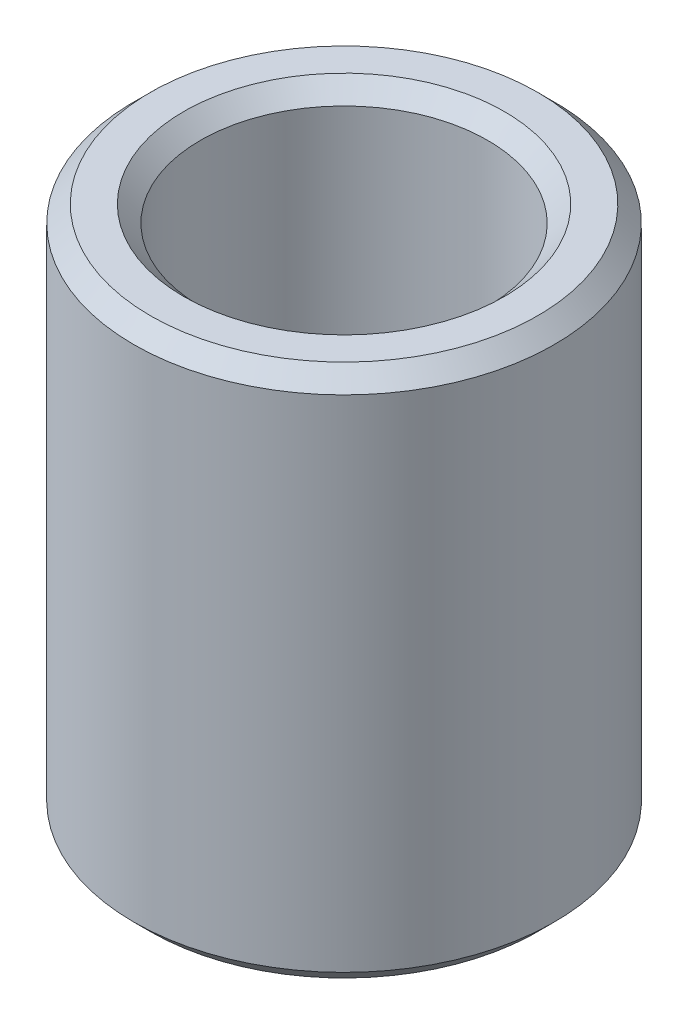
from build123d import *

# Parameters (mm, degrees)
SKETCH1_R           = 35
BOSS_EXTRUDE1_DEPTH = 88.798494219
SKETCH2_R           = 23.917795203
CUT_EXTRUDE1_DEPTH  = 102.662050813
CHAMFER1_SIZE       = 2.770905919


with BuildPart() as part:
    # Sketch1 → Boss-Extrude1 (new body)
    with BuildSketch(Plane(origin=(0, 0, 0), x_dir=(1, 0, 0), z_dir=(0, 1, 0))):
        Circle(SKETCH1_R)
    extrude(amount=BOSS_EXTRUDE1_DEPTH)

    # Sketch2 → Cut-Extrude1 (cut, through all)
    with BuildSketch(Plane(origin=(0, 0, 0), x_dir=(1, 0, 0), z_dir=(0, 1, 0))):
        Circle(SKETCH2_R)
    extrude(amount=CUT_EXTRUDE1_DEPTH, mode=Mode.SUBTRACT)

    # Chamfer1
    chamfer1_edges = [part.edges().sort_by_distance(p)[0] for p in [
        (-23.917795203, 88.798494219, 0),
        (-23.917795203, 0, 0),
        (-35, 0, 0),
        (-35, 88.798494219, 0),
    ]]
    chamfer(chamfer1_edges, length=CHAMFER1_SIZE)


solid = part.part
